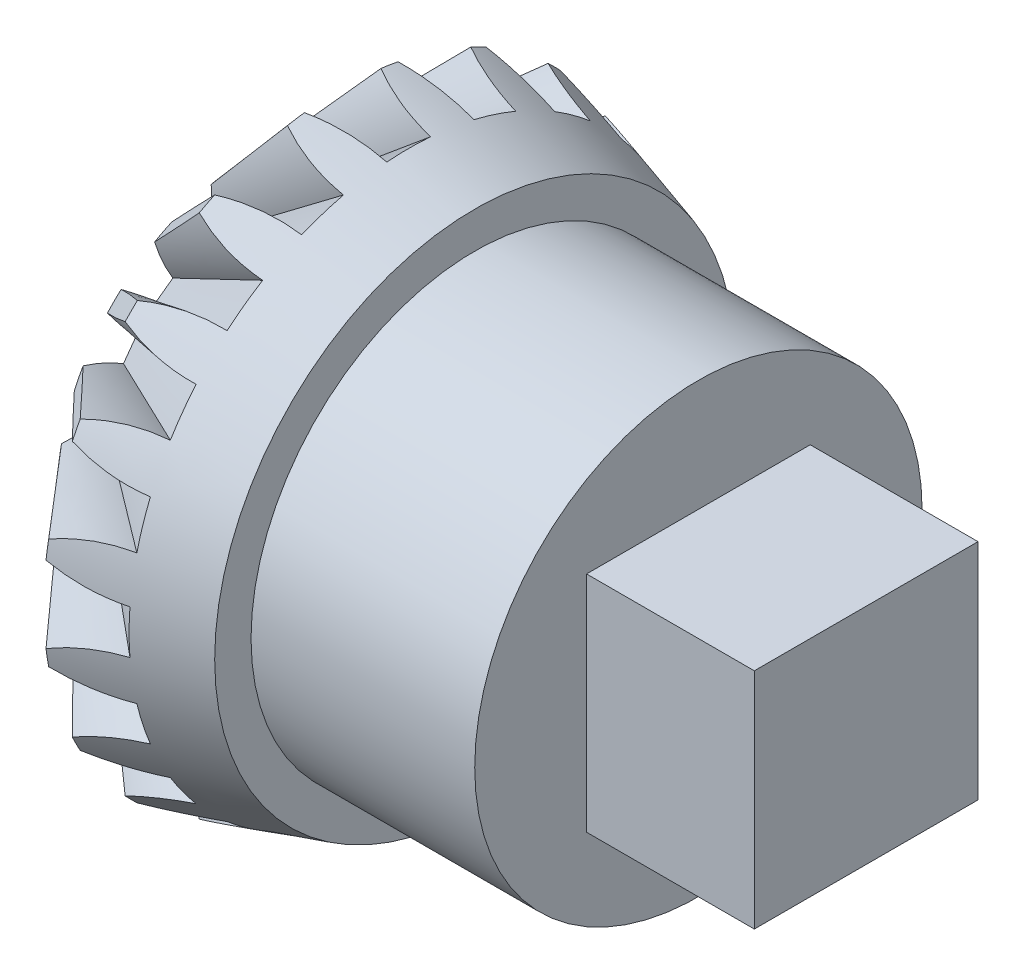
from build123d import *

# Parameters (mm, degrees)
CIRPATTERN1_COUNT   = 20
SKETCH9_W           = 4
SKETCH9_H           = 4
BOSS_EXTRUDE1_DEPTH = 3
BOSS_EXTRUDE2_REACH = 15.316
SKETCH10_R          = 1.5


with BuildPart() as part:
    # Sketch1 → Revolve1 (revolve)
    with BuildSketch(Plane.XY):
        Polygon((0, 1.5), (8, 1.5), (8, 4), (4, 4), (4, 4.65), (1.639708456, 5.35), (0, 3.462844421), align=None)
    revolve(axis=Axis((0, 0, 0), (1, 0, 0)))

    # Sketch6 for Cut-Loft1 → Cut-Loft1 section 0
    with BuildSketch(Plane(origin=(2.819854228, 0, 0), x_dir=(0, 0, -1), z_dir=(1, 0, 0))):
        with BuildLine():
            Line((-2.607480562, 8.025), (2.607480562, 8.025))
            # circular arc as an exact rational Bezier (weights 1, cos(half-angle), 1)
            Bezier((2.607480562, 8.025), (0.565515721, 7.185558531), (0.392295479, 4.984586669), weights=[1, 0.851943225, 1])
            Bezier((0.392295479, 4.984586669), (0, 5.015460992), (-0.392295479, 4.984586669), weights=[1, 0.996917334, 1])
            Bezier((-0.392295479, 4.984586669), (-0.565515721, 7.185558531), (-2.607480562, 8.025), weights=[1, 0.851943225, 1])
        make_face()
    # Sketch5 for Cut-Loft1 → Cut-Loft1 section 1
    with BuildSketch(Plane.ZY):
        with BuildLine():
            Line((-0.209878081, 2.666753868), (0.209878081, 2.666753868))
            Bezier((0.209878081, 2.666753868), (0.33323155, 4.2341083), (1.65324092, 5.088152362), weights=[1, 0.896497279, 1])
            Bezier((1.65324092, 5.088152362), (0, 5.6253229), (-1.65324092, 5.088152362), weights=[1, 0.951056516, 1])
            Bezier((-1.65324092, 5.088152362), (-0.33323155, 4.2341083), (-0.209878081, 2.666753868), weights=[1, 0.896497279, 1])
        make_face()
    cut_loft1 = loft(mode=Mode.SUBTRACT)

    # CirPattern1: Cut-Loft1 ×20 about axis
    cirpattern1_axis = Axis((0, 0, 0), (-1, 0, 0))
    for i in range(1, CIRPATTERN1_COUNT):
        add(cut_loft1.rotate(cirpattern1_axis, i * 360 / CIRPATTERN1_COUNT), mode=Mode.SUBTRACT)

    # Sketch9 → Boss-Extrude1 (add)
    with BuildSketch(Plane(origin=(8, 0, 0), x_dir=(0, 0, -1), z_dir=(1, 0, 0))):
        Rectangle(SKETCH9_W, SKETCH9_H)
    extrude(amount=BOSS_EXTRUDE1_DEPTH)

    # Sketch10 → Boss-Extrude2 (add, up to next)
    with BuildSketch(Plane.ZY, mode=Mode.PRIVATE) as boss_extrude2_sk1:
        Circle(SKETCH10_R)
    boss_extrude2_tool1 = extrude(boss_extrude2_sk1.sketch, amount=-BOSS_EXTRUDE2_REACH, mode=Mode.PRIVATE) - part.part
    add(boss_extrude2_tool1.solids().sort_by_distance((0, 0, 0))[0])


solid = part.part
